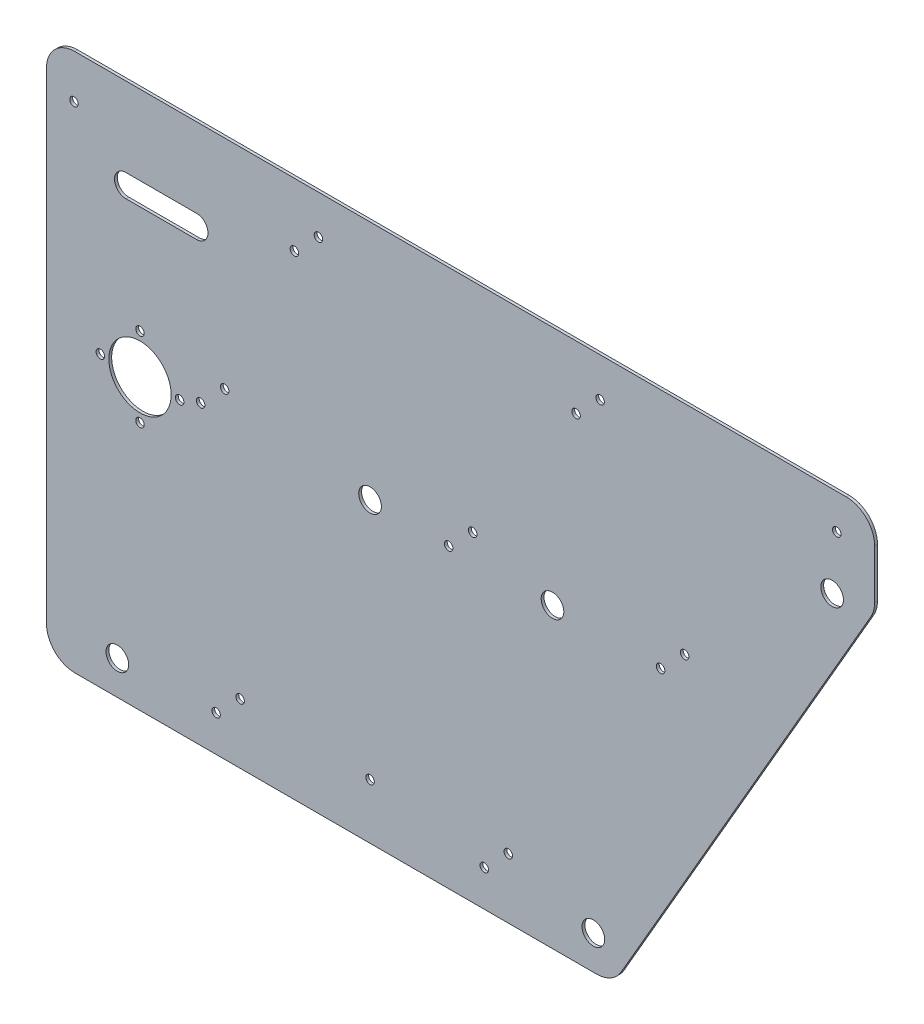
from build123d import *

# Parameters (mm, degrees)
BOSS_EXTRUDE1_DEPTH = 1
FILLET1_R           = 10
SKETCH2_R           = 4
SKETCH2_R_2         = 11
SKETCH2_R_3         = 1.5
CUT_EXTRUDE1_DEPTH  = 3


with BuildPart() as part:
    # Sketch1 → Boss-Extrude1 (new body)
    with BuildSketch(Plane.XY):
        Polygon((-100, 110), (-100, -80), (100, -80), (192.37604307, 80), (192.37604307, 110), align=None)
    extrude(amount=BOSS_EXTRUDE1_DEPTH)

    # Fillet1
    fillet1_edges = [part.edges().sort_by_distance(p)[0] for p in [
        (100, -80, 0.5),
        (-100, -80, 0.5),
        (192.37604307, 110, 0.5),
        (192.37604307, 80, 0.5),
        (-100, 110, 0.5),
    ]]
    fillet(fillet1_edges, radius=FILLET1_R)

    # Sketch2 → Cut-Extrude1 (cut)
    with BuildSketch(Plane.XY.offset(1)):
        with Locations((93.07179677, -68)):
            Circle(SKETCH2_R)
        with Locations((177.364936071, 78)):
            Circle(SKETCH2_R)
        with Locations((-67, 22)):
            Circle(SKETCH2_R_2)
        with Locations((-75, -68)):
            Circle(SKETCH2_R)
        with Locations((-53, 22)):
            Circle(SKETCH2_R_3)
        with Locations((-67, 36)):
            Circle(SKETCH2_R_3)
        with Locations((-81, 22)):
            Circle(SKETCH2_R_3)
        with Locations((-67, 8)):
            Circle(SKETCH2_R_3)
        with Locations((54.54952947, -67.242640687)):
            Circle(SKETCH2_R_3)
        with Locations((63.034810844, -58.757359313)):
            Circle(SKETCH2_R_3)
        with Locations((14.225855729, -60.5)):
            Circle(SKETCH2_R_3)
        with Locations((-40.127135228, -67.242640687)):
            Circle(SKETCH2_R_3)
        with Locations((-31.641853854, -58.757359313)):
            Circle(SKETCH2_R_3)
        with Locations((-90.295627115, 94.5)):
            Circle(SKETCH2_R_3)
        with Locations((-12.482801161, 87.757359313)):
            Circle(SKETCH2_R_3)
        with Locations((-3.997519787, 96.242640687)):
            Circle(SKETCH2_R_3)
        with Locations((86.965374539, 87.757359313)):
            Circle(SKETCH2_R_3)
        with Locations((95.450655913, 96.242640687)):
            Circle(SKETCH2_R_3)
        with Locations((41.969500075, 24.757359313)):
            Circle(SKETCH2_R_3)
        with Locations((50.454781449, 33.242640687)):
            Circle(SKETCH2_R_3)
        with Locations((-45.601368119, 24.757359313)):
            Circle(SKETCH2_R_3)
        with Locations((-37.116086745, 33.242640687)):
            Circle(SKETCH2_R_3)
        with Locations((116.811272287, 24.757359313)):
            Circle(SKETCH2_R_3)
        with Locations((125.296553661, 33.242640687)):
            Circle(SKETCH2_R_3)
        with Locations((78.638243285, 25)):
            Circle(SKETCH2_R)
        with Locations((14.225855729, 25)):
            Circle(SKETCH2_R)
        with Locations((178.99327299, 97.609508858)):
            Circle(SKETCH2_R_3)
        with BuildLine():
            Line((-72, 82), (-47, 82))
            ThreePointArc((-47, 82), (-43, 78), (-47, 74))
            Line((-47, 74), (-72, 74))
            ThreePointArc((-72, 74), (-76, 78), (-72, 82))
        make_face()
    extrude(amount=-CUT_EXTRUDE1_DEPTH, mode=Mode.SUBTRACT)


solid = part.part
